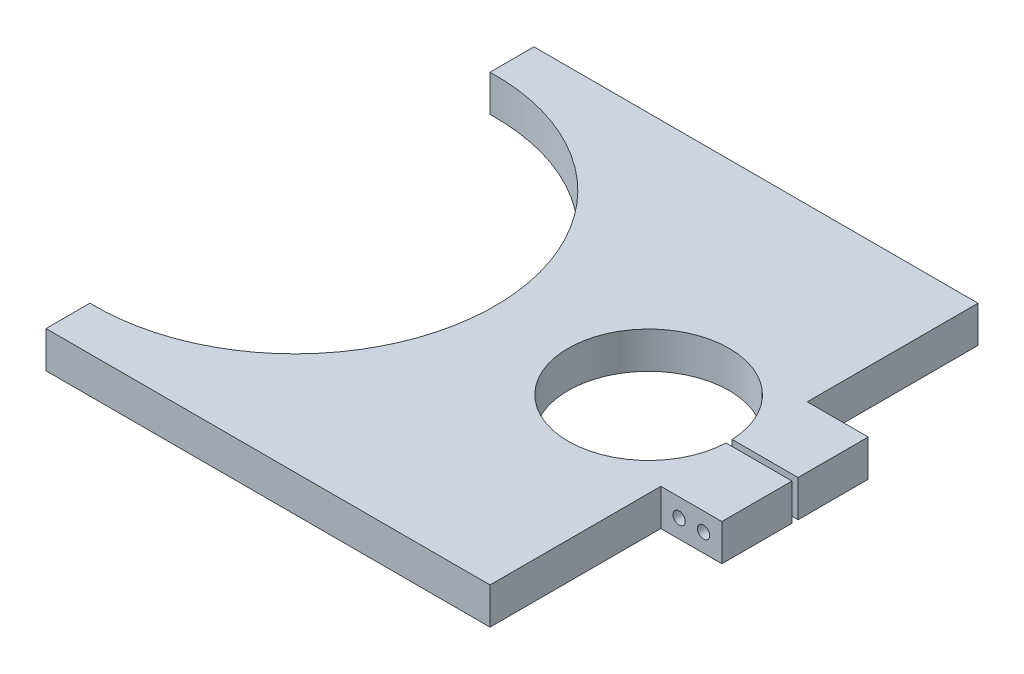
from build123d import *

# Parameters (mm, degrees)
SKETCH1_R           = 20.955
BOSS_EXTRUDE1_DEPTH = 9.525
SKETCH3_W           = 19.721267632
SKETCH3_H           = 1.5875
CUT_EXTRUDE1_DEPTH  = 184.023259861
SKETCH4_W           = 15.875
SKETCH4_H           = 44.45
CUT_EXTRUDE5_DEPTH  = 184.023259861
SKETCH7_R           = 1.5875
CUT_EXTRUDE6_DEPTH  = 156.508894119


with BuildPart() as part:
    # Sketch1 → Boss-Extrude1 (new body)
    with BuildSketch(Plane(origin=(0, 0, 0), x_dir=(1, 0, 0), z_dir=(0, 1, 0))):
        with BuildLine():
            Line((0, 0), (131.445, 0))
            Line((131.445, 0), (131.445, 127))
            Line((131.445, 127), (0, 127))
            Line((0, 127), (0, 115.57))
            ThreePointArc((0, 115.57), (53.34, 63.5), (0, 11.43))
            Line((0, 11.43), (0, 0))
        make_face()
        with Locations((93.345, 63.5)):
            Circle(SKETCH1_R, mode=Mode.SUBTRACT)
    extrude(amount=BOSS_EXTRUDE1_DEPTH)

    # Sketch3 → Cut-Extrude1 (cut, through all)
    with BuildSketch(Plane(origin=(0, 9.525, 0), x_dir=(1, 0, 0), z_dir=(0, 1, 0))):
        with Locations((121.584366184, 63.5)):
            Rectangle(SKETCH3_W, SKETCH3_H)
    extrude(amount=-CUT_EXTRUDE1_DEPTH, mode=Mode.SUBTRACT)

    # Sketch4 → Cut-Extrude5 (cut, through all)
    with BuildSketch(Plane(origin=(0, 9.525, 0), x_dir=(1, 0, 0), z_dir=(0, 1, 0))):
        with Locations((123.5075, 104.775)):
            Rectangle(SKETCH4_W, SKETCH4_H)
        with Locations((123.5075, 22.225)):
            Rectangle(SKETCH4_W, SKETCH4_H)
    extrude(amount=-CUT_EXTRUDE5_DEPTH, mode=Mode.SUBTRACT)

    # Sketch7 → Cut-Extrude6 (cut, through all)
    with BuildSketch(Plane.XY.offset(-44.45)):
        with Locations((126.6825, 4.7625)):
            Circle(SKETCH7_R)
        with Locations((120.3325, 4.7625)):
            Circle(SKETCH7_R)
    extrude(amount=-CUT_EXTRUDE6_DEPTH, mode=Mode.SUBTRACT)


solid = part.part
